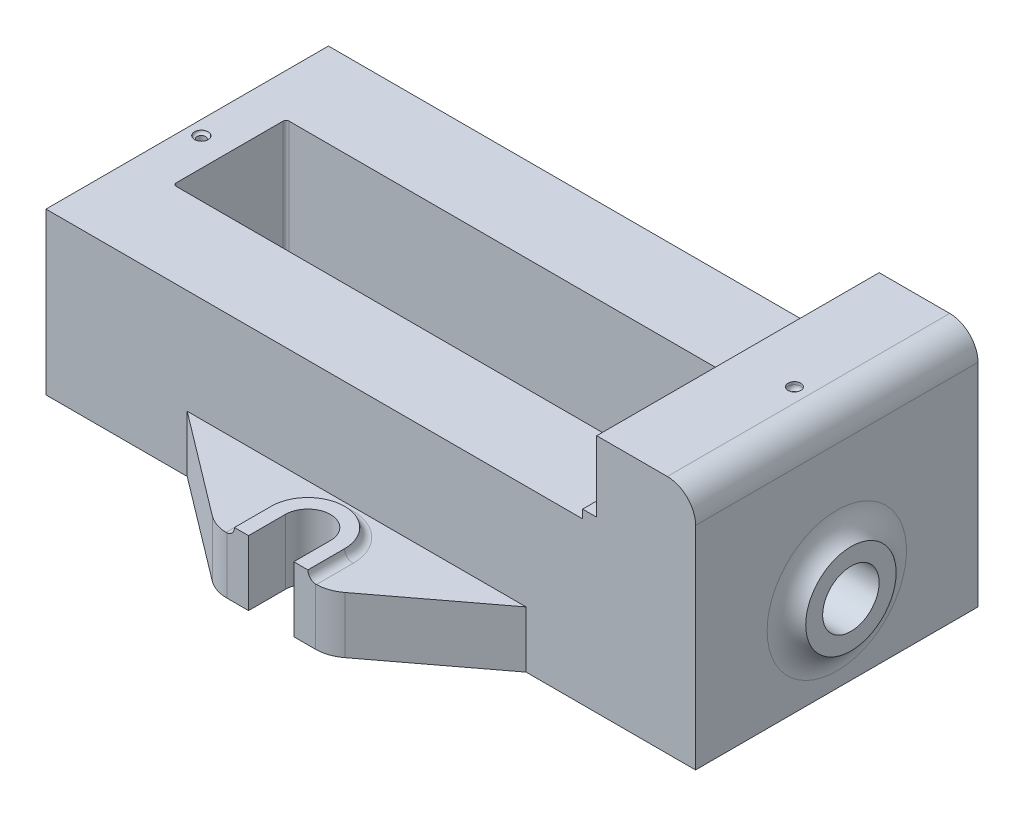
from build123d import *

# Parameters (mm, degrees)
BOSS_EXTRUDE1_DEPTH     = 100
SKETCH2_R               = 16
BOSS_EXTRUDE2_DEPTH     = 5
FILLET1_R               = 10
SKETCH3_R               = 16
BOSS_EXTRUDE3_DEPTH     = 5
FILLET2_R               = 10
SKETCH4_R               = 5
CUT_EXTRUDE1_DEPTH      = 20
CUT_EXTRUDE2_DEPTH      = 191.110529256
CUT_EXTRUDE3_REACH      = 275.542
SKETCH6_R               = 10
BOSS_EXTRUDE5_DEPTH     = 20
BOSS_EXTRUDE6_DEPTH     = 3
FILLET3_R               = 3
BOSS_EXTRUDE7_DEPTH     = 3
FILLET4_R               = 3
CUT_EXTRUDE4_REACH      = 209.638
CUT_EXTRUDE4_END_RADIUS = 5
SKETCH14_R              = 1.5
SKETCH15_R              = 2.411776211
CUT_EXTRUDE5_DEPTH      = 1
FILLET5_R               = 1
SKETCH16_R              = 2.5
CUT_EXTRUDE6_DEPTH      = 13
SKETCH18_R              = 3
CUT_EXTRUDE7_DEPTH      = 10
FILLET6_R               = 1
SKETCH20_R              = 3
CUT_EXTRUDE8_DEPTH      = 10
FILLET7_R               = 1
CUT_EXTRUDE9_REACH      = 219.001
CUT_EXTRUDE9_END_RADIUS = 10
SKETCH21_R              = 1.5
SKETCH22_R              = 2.25
CUT_EXTRUDE10_DEPTH     = 2.5
FILLET8_R               = 2
SKETCH23_W              = 175
SKETCH23_H              = 52
CUT_EXTRUDE11_DEPTH     = 13
SKETCH25_W              = 175
SKETCH25_H              = 60
CUT_EXTRUDE12_DEPTH     = 10
FILLET9_R               = 5


# Some blends are built 0.0001 mm under size
with BuildPart() as part:
    # Sketch1 → Boss-Extrude1 (new body)
    with BuildSketch(Plane.XY):
        with BuildLine():
            Line((146.304373149, 0), (146.304373149, 75))
            ThreePointArc((146.304373149, 75), (143.375440961, 82.071067812), (136.304373149, 85))
            Line((136.304373149, 85), (111.304373149, 85))
            Line((111.304373149, 85), (111.304373149, 60))
            Line((111.304373149, 60), (106.304373149, 60))
            Line((106.304373149, 60), (106.304373149, 57))
            Line((106.304373149, 57), (-83.695626851, 57))
            Line((-83.695626851, 57), (-83.695626851, 0))
            Line((-83.695626851, 0), (146.304373149, 0))
        make_face()
    extrude(amount=BOSS_EXTRUDE1_DEPTH)

    # Sketch2 → Boss-Extrude2 (add)
    with BuildSketch(Plane(origin=(146.304373149, 0, 0), x_dir=(0, 0, -1), z_dir=(1, 0, 0))):
        with Locations(Location((-50, 30, 0), (0, 0, 180))):
            Circle(SKETCH2_R)
    extrude(amount=BOSS_EXTRUDE2_DEPTH)

    # Fillet1
    # the kernel refuses this fillet: 10 mm, written as the material it adds along each edge
    with BuildSketch(Plane(origin=(146.304373149, 30, 50), x_dir=(0, 0, 1), z_dir=(0, 1, 0))) as fillet1_piece_1:
        with BuildLine():
            CenterArc((24.660254038, 10), FILLET1_R, 210, 60)
            Line((16, 5), (15.826794919, 4.9))
            ThreePointArc((15.826794919, 4.9), (15.8, 2.5), (15.8, 0))
            Line((15.8, 0), (16, -0.2))
            Line((16, -0.2), (24.660254038, -0.2))
            Line((24.660254038, -0.2), (24.660254038, 0))
        make_face()
    revolve(axis=Axis((146.304373149, 30, 50), (1, 0, 0)))

    # Sketch3 → Boss-Extrude3 (add)
    with BuildSketch(Plane.ZY.offset(83.695626851)):
        with Locations(Location((50, 30, 0), (0, 0, 90))):
            Circle(SKETCH3_R)
    extrude(amount=BOSS_EXTRUDE3_DEPTH)

    # Fillet2
    # the kernel refuses this fillet: 10 mm, written as the material it adds along each edge
    with BuildSketch(Plane(origin=(-83.695626851, 30, 50), x_dir=(0, 1, 0), z_dir=(0, 0, 1))) as fillet2_piece_1:
        with BuildLine():
            CenterArc((24.660254038, 10), FILLET2_R, 210, 60)
            Line((16, 5), (15.826794919, 4.9))
            ThreePointArc((15.826794919, 4.9), (15.8, 2.5), (15.8, 0))
            Line((15.8, 0), (16, -0.2))
            Line((16, -0.2), (24.660254038, -0.2))
            Line((24.660254038, -0.2), (24.660254038, 0))
        make_face()
    revolve(axis=Axis((-83.695626851, 30, 50), (-1, 0, 0)))

    # Sketch4 → Cut-Extrude1 (cut)
    with BuildSketch(Plane.ZY.offset(88.695626851)):
        with Locations(Location((50, 30, 0), (0, 0, 270))):
            Circle(SKETCH4_R)
    extrude(amount=-CUT_EXTRUDE1_DEPTH, mode=Mode.SUBTRACT)

    # Sketch5 → Cut-Extrude2 (cut, through all)
    with BuildSketch(Plane(origin=(0, 57, 0), x_dir=(1, 0, 0), z_dir=(0, 1, 0))):
        with BuildLine():
            Line((-67.695626851, -30), (105.304373149, -30))
            ThreePointArc((105.304373149, -30), (106.011479931, -30.292893219), (106.304373149, -31))
            Line((106.304373149, -31), (106.304373149, -69))
            ThreePointArc((106.304373149, -69), (106.011479931, -69.707106781), (105.304373149, -70))
            Line((105.304373149, -70), (-67.695626851, -70))
            ThreePointArc((-67.695626851, -70), (-68.402733632, -69.707106781), (-68.695626851, -69))
            Line((-68.695626851, -69), (-68.695626851, -31))
            ThreePointArc((-68.695626851, -31), (-68.402733632, -30.292893219), (-67.695626851, -30))
        make_face()
    extrude(amount=-CUT_EXTRUDE2_DEPTH, mode=Mode.SUBTRACT)

    # Sketch6 → Cut-Extrude3 (cut, up to next)
    with BuildSketch(Plane(origin=(151.304373149, 0, 0), x_dir=(0, 0, -1), z_dir=(1, 0, 0)), mode=Mode.PRIVATE) as cut_extrude3_sk1:
        with Locations((-50, 30)):
            Circle(SKETCH6_R)
    cut_extrude3_tool1 = extrude(cut_extrude3_sk1.sketch, amount=-CUT_EXTRUDE3_REACH, mode=Mode.PRIVATE) & part.part
    add(cut_extrude3_tool1.solids().sort_by_distance((151.304373, 30, 50))[0], mode=Mode.SUBTRACT)

    # Sketch7 → Boss-Extrude5 (add)
    with BuildSketch(Plane.XZ):
        with BuildLine():
            Line((-33.695626851, 100), (86.304373149, 100))
            Line((86.304373149, 100), (49.784876297, 127.640670506))
            ThreePointArc((49.784876297, 127.640670506), (46.077337967, 129.598813846), (41.939346526, 130.274974069))
            Line((41.939346526, 130.274974069), (34.304373149, 130.274974069))
            Line((34.304373149, 130.274974069), (34.304373149, 117.274974069))
            ThreePointArc((34.304373149, 117.274974069), (26.304373149, 109.274974069), (18.304373149, 117.274974069))
            Line((18.304373149, 117.274974069), (18.304373149, 130.274974069))
            Line((18.304373149, 130.274974069), (10.669399773, 130.274974069))
            ThreePointArc((10.669399773, 130.274974069), (6.531408332, 129.598813846), (2.823870002, 127.640670506))
            Line((2.823870002, 127.640670506), (-33.695626851, 100))
        make_face()
        with BuildLine():
            Line((18.304373149, -30.274974069), (18.304373149, -17.274974069))
            ThreePointArc((18.304373149, -17.274974069), (26.304373149, -9.274974069), (34.304373149, -17.274974069))
            Line((34.304373149, -17.274974069), (34.304373149, -30.274974069))
            Line((34.304373149, -30.274974069), (41.939346526, -30.274974069))
            ThreePointArc((41.939346526, -30.274974069), (46.077337967, -29.598813846), (49.784876297, -27.640670506))
            Line((49.784876297, -27.640670506), (86.304373149, 0))
            Line((86.304373149, 0), (-33.695626851, 0))
            Line((-33.695626851, 0), (2.823870002, -27.640670506))
            ThreePointArc((2.823870002, -27.640670506), (6.531408332, -29.598813846), (10.669399773, -30.274974069))
            Line((10.669399773, -30.274974069), (18.304373149, -30.274974069))
        make_face()
    extrude(amount=-BOSS_EXTRUDE5_DEPTH)

    # Sketch8 → Boss-Extrude6 (add)
    with BuildSketch(Plane(origin=(0, 20, 0), x_dir=(1, 0, 0), z_dir=(0, 1, 0))):
        with BuildLine():
            ThreePointArc((13.304373149, 17.274974069), (26.304373149, 4.274974069), (39.304373149, 17.274974069))
            Line((39.304373149, 17.274974069), (39.304373149, 30.274974069))
            Line((39.304373149, 30.274974069), (34.304373149, 30.274974069))
            Line((34.304373149, 30.274974069), (34.304373149, 17.556485004))
            Line((34.304373149, 17.556485004), (34.304373149, 17.274974069))
            ThreePointArc((34.304373149, 17.274974069), (26.304373149, 9.274974069), (18.304373149, 17.274974069))
            Line((18.304373149, 17.274974069), (18.304373149, 30.274974069))
            Line((18.304373149, 30.274974069), (13.304373149, 30.274974069))
            Line((13.304373149, 30.274974069), (13.304373149, 17.274974069))
        make_face()
    extrude(amount=BOSS_EXTRUDE6_DEPTH)

    # Fillet3
    fillet3_edges = [part.edges().sort_by_distance(p)[0] for p in [
        (39.304373149, 20, -23.774974069),
        (26.304373149, 20, -4.274974069),
        (13.304373149, 20, -23.774974069),
    ]]
    fillet(fillet3_edges, radius=FILLET3_R - 0.0001)  # a hair under: the kernel refuses the full size

    # Sketch10 → Boss-Extrude7 (add)
    with BuildSketch(Plane(origin=(0, 20, 0), x_dir=(1, 0, 0), z_dir=(0, 1, 0))):
        with BuildLine():
            ThreePointArc((39.304373149, -117.274974069), (26.304373149, -104.274974069), (13.304373149, -117.274974069))
            Line((13.304373149, -117.274974069), (13.304373149, -130.274974069))
            Line((13.304373149, -130.274974069), (18.304373149, -130.274974069))
            Line((18.304373149, -130.274974069), (18.304373149, -117.274974069))
            ThreePointArc((18.304373149, -117.274974069), (26.304373149, -109.274974069), (34.304373149, -117.274974069))
            Line((34.304373149, -117.274974069), (34.304373149, -130.274974069))
            Line((34.304373149, -130.274974069), (39.304373149, -130.274974069))
            Line((39.304373149, -130.274974069), (39.304373149, -117.274974069))
        make_face()
    extrude(amount=BOSS_EXTRUDE7_DEPTH)

    # Fillet4
    fillet4_edges = [part.edges().sort_by_distance(p)[0] for p in [
        (13.304373149, 20, 123.774974069),
        (26.304373149, 20, 104.274974069),
        (39.304373149, 20, 123.774974069),
    ]]
    fillet(fillet4_edges, radius=FILLET4_R - 0.0001)  # a hair under: the kernel refuses the full size

    # Cut-Extrude4: up to this cylinder (the profile starts outside it)
    cut_extrude4_end = Plane(origin=(-78.695627, 30, 50), z_dir=(-1, 0, 0)) * Cylinder(CUT_EXTRUDE4_END_RADIUS, 430.276, mode=Mode.PRIVATE)
    # Sketch14 → Cut-Extrude4 (cut, up to the surface)
    with BuildSketch(Plane(origin=(0, 57, 0), x_dir=(1, 0, 0), z_dir=(0, 1, 0)), mode=Mode.PRIVATE) as cut_extrude4_sk1:
        with Locations(Location((-78.695626851, -50, 0), (0, 0, 180))):
            Circle(SKETCH14_R)
    cut_extrude4_tool1 = extrude(cut_extrude4_sk1.sketch, amount=-CUT_EXTRUDE4_REACH, mode=Mode.PRIVATE) - cut_extrude4_end
    add(cut_extrude4_tool1.solids().sort_by_distance((-78.695627, 57, 50))[0], mode=Mode.SUBTRACT)

    # Sketch15 → Cut-Extrude5 (cut)
    with BuildSketch(Plane(origin=(0, 57, 0), x_dir=(1, 0, 0), z_dir=(0, 1, 0))):
        with Locations(Location((-78.695626851, -50, 0), (0, 0, 180))):
            Circle(SKETCH15_R)
    extrude(amount=-CUT_EXTRUDE5_DEPTH, mode=Mode.SUBTRACT)

    # Fillet5
    # the kernel refuses this fillet: 1 mm, written as the material it adds along each edge
    with BuildSketch(Plane(origin=(-78.695626851, 56, 50), x_dir=(-1, 0, 0), z_dir=(0, 0, -1))) as fillet5_piece_1:
        with BuildLine():
            CenterArc((1.411776211, 0.996100679), FILLET5_R, 275.061431189, 84.938568811)
            Line((1.5, 0), (1.501764476, -0.019922014))
            ThreePointArc((1.501764476, -0.019922014), (1.955888106, -0.02), (2.411776211, -0.02))
            Line((2.411776211, -0.02), (2.431776211, 0))
            Line((2.431776211, 0), (2.431776211, 0.996100679))
            Line((2.431776211, 0.996100679), (2.411776211, 0.996100679))
        make_face()
    revolve(axis=Axis((-78.695626851, 56, 50), (0, 1, 0)))

    # Sketch16 → Cut-Extrude6 (cut)
    with BuildSketch(Plane.ZY.offset(-111.304373149)):
        with Locations((80, 72.5)):
            Circle(SKETCH16_R)
        with Locations((20, 72.5)):
            Circle(SKETCH16_R)
    extrude(amount=-CUT_EXTRUDE6_DEPTH, mode=Mode.SUBTRACT)

    # Sketch18 → Cut-Extrude7 (cut)
    with BuildSketch(Plane.ZY.offset(-111.304373149)):
        with Locations((80, 72.5)):
            Circle(SKETCH18_R)
    extrude(amount=-CUT_EXTRUDE7_DEPTH, mode=Mode.SUBTRACT)

    # Fillet6
    # the kernel refuses this fillet: 1 mm, written as the material it adds along each edge
    with BuildSketch(Plane(origin=(121.304373149, 72.5, 80), x_dir=(0, 0, 1), z_dir=(0, -1, 0))) as fillet6_piece_1:
        with BuildLine():
            CenterArc((2, 0.866025404), FILLET6_R, 300, 60)
            Line((2.5, 0), (2.51, -0.017320508))
            ThreePointArc((2.51, -0.017320508), (2.75, -0.02), (3, -0.02))
            Line((3, -0.02), (3.02, 0))
            Line((3.02, 0), (3.02, 0.866025404))
            Line((3.02, 0.866025404), (3, 0.866025404))
        make_face()
    revolve(axis=Axis((121.304373149, 72.5, 80), (-1, 0, 0)))

    # Sketch20 → Cut-Extrude8 (cut)
    with BuildSketch(Plane.ZY.offset(-111.304373149)):
        with Locations((20, 72.5)):
            Circle(SKETCH20_R)
    extrude(amount=-CUT_EXTRUDE8_DEPTH, mode=Mode.SUBTRACT)

    # Fillet7
    # the kernel refuses this fillet: 1 mm, written as the material it adds along each edge
    with BuildSketch(Plane(origin=(121.304373149, 72.5, 20), x_dir=(0, 0, 1), z_dir=(0, -1, 0))) as fillet7_piece_1:
        with BuildLine():
            CenterArc((2, 0.866025404), FILLET7_R, 300, 60)
            Line((2.5, 0), (2.51, -0.017320508))
            ThreePointArc((2.51, -0.017320508), (2.75, -0.02), (3, -0.02))
            Line((3, -0.02), (3.02, 0))
            Line((3.02, 0), (3.02, 0.866025404))
            Line((3.02, 0.866025404), (3, 0.866025404))
        make_face()
    revolve(axis=Axis((121.304373149, 72.5, 20), (-1, 0, 0)))

    # Cut-Extrude9: up to this cylinder (the profile starts outside it)
    cut_extrude9_end = Plane(origin=(131.304373, 30, 50), z_dir=(1, 0, 0)) * Cylinder(CUT_EXTRUDE9_END_RADIUS, 459.002, mode=Mode.PRIVATE)
    # Sketch21 → Cut-Extrude9 (cut, up to the surface)
    with BuildSketch(Plane(origin=(0, 85, 0), x_dir=(1, 0, 0), z_dir=(0, 1, 0)), mode=Mode.PRIVATE) as cut_extrude9_sk1:
        with Locations(Location((131.304373149, -50, 0), (0, 0, 270))):
            Circle(SKETCH21_R)
    cut_extrude9_tool1 = extrude(cut_extrude9_sk1.sketch, amount=-CUT_EXTRUDE9_REACH, mode=Mode.PRIVATE) - cut_extrude9_end
    add(cut_extrude9_tool1.solids().sort_by_distance((131.304373, 85, 50))[0], mode=Mode.SUBTRACT)

    # Sketch22 → Cut-Extrude10 (cut)
    with BuildSketch(Plane(origin=(0, 85, 0), x_dir=(1, 0, 0), z_dir=(0, 1, 0))):
        with Locations(Location((131.304373149, -50, 0), (0, 0, 270))):
            Circle(SKETCH22_R)
    extrude(amount=-CUT_EXTRUDE10_DEPTH, mode=Mode.SUBTRACT)

    # Fillet8
    # the kernel refuses this fillet: 2 mm, written as the material it adds along each edge
    with BuildSketch(Plane(origin=(131.304373149, 82.5, 50), x_dir=(0, 0, 1), z_dir=(-1, 0, 0))) as fillet8_piece_1:
        with BuildLine():
            CenterArc((0.25, 1.5612495), FILLET8_R, 308.682187453, 51.317812547)
            Line((1.5, 0), (1.525, -0.03122499))
            ThreePointArc((1.525, -0.03122499), (1.875, -0.04), (2.25, -0.04))
            Line((2.25, -0.04), (2.29, 0))
            Line((2.29, 0), (2.29, 1.5612495))
            Line((2.29, 1.5612495), (2.25, 1.5612495))
        make_face()
    revolve(axis=Axis((131.304373149, 82.5, 50), (0, 1, 0)))

    # Sketch23 → Cut-Extrude11 (cut)
    with BuildSketch(Plane.XZ):
        with Locations((18.804373149, 50)):
            Rectangle(SKETCH23_W, SKETCH23_H)
    extrude(amount=-CUT_EXTRUDE11_DEPTH, mode=Mode.SUBTRACT)

    # Sketch25 → Cut-Extrude12 (cut)
    with BuildSketch(Plane.XZ):
        with Locations((18.804373149, 50)):
            Rectangle(SKETCH25_W, SKETCH25_H)
    extrude(amount=-CUT_EXTRUDE12_DEPTH, mode=Mode.SUBTRACT)

    # Fillet9
    # the kernel refuses this fillet: 5 mm, written as the material it adds along each edge
    with BuildSketch(Plane(origin=(-80.943075564, 10, 80), x_dir=(0, -1.5667467323505199e-12, -1.0), z_dir=(1, 0, 0)), Plane(origin=(118.551821863, 10, 20), x_dir=(0, -1.5742962489179645e-12, 1.0), z_dir=(-1, 0, 0))) as fillet9_piece_1:
        with BuildLine():
            CenterArc((5, -4.898979486), FILLET9_R, 101.536959033, 78.463040967)
            Line((0, -4.898979486), (-0.1, -4.898979486))
            Line((-0.1, -4.898979486), (-0.1, 0))
            Line((-0.1, 0), (0, 0.1))
            ThreePointArc((0, 0.1), (2, 0.1), (3.98, 0.09797959))
            Line((3.98, 0.09797959), (4, 0))
        make_face()
    extrude(amount=199.494897428)


solid = part.part
